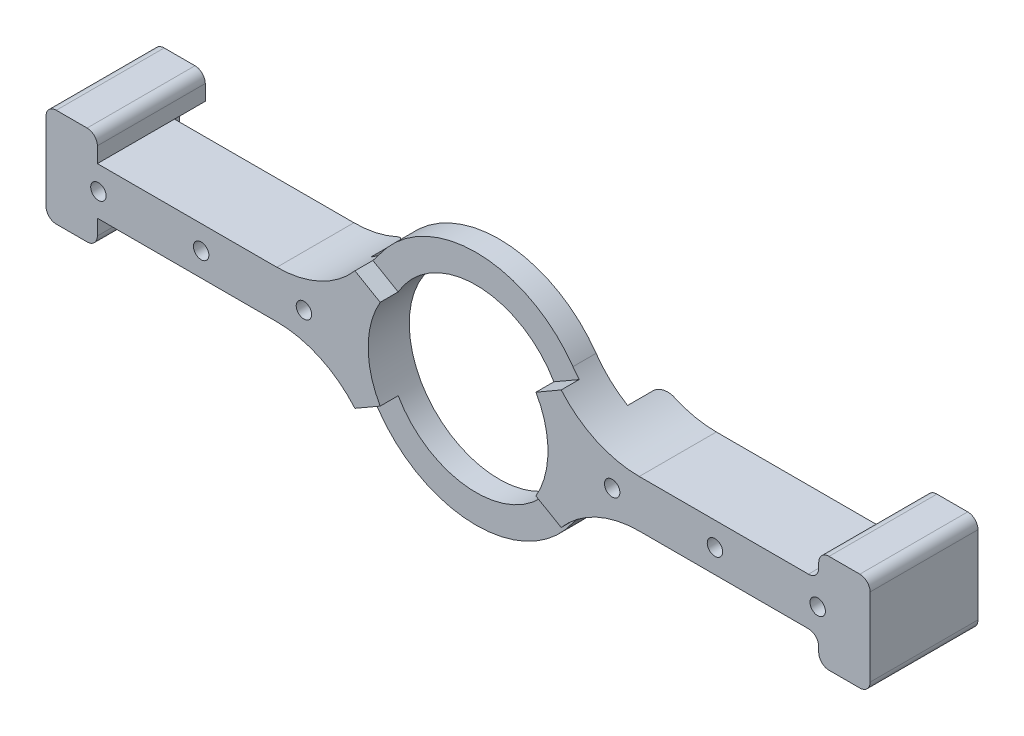
from build123d import *
from build123d.topology import SkipClean

# Parameters (mm, degrees)
SKETCH_1_R                  = 17.500000000000004
SKETCH_1_R_2                = 1.4999999999999971
SKETCH_1_R_3                = 1.4999999999999967
SKETCH_1_R_4                = 1.499999999999997
EXTRUDE_1_DEPTH             = 8
CUT_EXTRUDE_START           = -3.5
CUT_EXTRUDE_1_DEPTH         = 3.5
FILLET_1_R                  = 20
EXTRUDE_START               = 7
SKETCH_3_R                  = 1.499999999999997
SKETCH_3_R_2                = 1.4999999999999967
SKETCH_3_R_3                = 1.4999999999999971
EXTRUDE_2_DEPTH             = 7
EXTRUDE_3_DEPTH             = 6
EXTRUDE_3_DIRECTION_2_REACH = 82.056
FILLET_2_R                  = 2


with BuildPart() as part:
    # Sketch 1 → 凸台-拉伸1 (new body)
    with BuildSketch(Plane.XY):
        with BuildLine():
            Line((22.535305633605237, 4.6), (75.19999999999999, 4.599999999999999))
            Line((75.19999999999999, 4.599999999999999), (75.19999999999999, -4.6000000000000005))
            Line((75.19999999999999, -4.6000000000000005), (22.535305633605237, -4.6))
            ThreePointArc((22.535305633605237, -4.6), (1.41e-15, -23), (-22.535305633605237, -4.6))
            Line((-22.535305633605237, -4.6), (-75.19999999999999, -4.6000000000000005))
            Line((-75.19999999999999, -4.6000000000000005), (-75.19999999999999, 4.599999999999999))
            Line((-75.19999999999999, 4.599999999999999), (-22.535305633605237, 4.6))
            ThreePointArc((-22.535305633605237, 4.6), (1.41e-15, 23), (22.535305633605237, 4.6))
        make_face()
        Circle(SKETCH_1_R, mode=Mode.SUBTRACT)
        with Locations((-69.99999999999999, 0)):
            Circle(SKETCH_1_R_2, mode=Mode.SUBTRACT)
        with Locations((-49.999999999999986, 0)):
            Circle(SKETCH_1_R_3, mode=Mode.SUBTRACT)
        with Locations((-29.999999999999986, 0)):
            Circle(SKETCH_1_R_4, mode=Mode.SUBTRACT)
        with Locations((30.00000000000003, 0)):
            Circle(SKETCH_1_R_3, mode=Mode.SUBTRACT)
        with Locations((50.00000000000003, 0)):
            Circle(SKETCH_1_R_3, mode=Mode.SUBTRACT)
        with Locations((70.00000000000001, 0)):
            Circle(SKETCH_1_R_2, mode=Mode.SUBTRACT)
    extrude(amount=EXTRUDE_1_DEPTH)

    # 草图2 → 切除-拉伸1 (cut)
    with BuildSketch(Plane.XY.offset(8).offset(CUT_EXTRUDE_START)):
        with BuildLine():
            ThreePointArc((19.918584287042115, 11.499999999999945), (8.9e-16, 23), (-19.91858428704211, 11.499999999999947))
            Line((-19.918584287042115, 11.499999999999943), (-15.155444566227704, 8.749999999999961))
            ThreePointArc((-15.15544456622793, 8.74999999999957), (1.07e-15, 17.500000000000004), (15.15544456622793, 8.749999999999568))
            Line((15.155444566227706, 8.749999999999966), (19.918584287042123, 11.499999999999952))
        make_face()
        with BuildLine():
            ThreePointArc((15.155444566227922, -8.749999999999579), (-3.21e-15, -17.500000000000004), (-15.155444566227935, -8.74999999999956))
            Line((-15.155444566227704, -8.749999999999961), (-19.918584287042123, -11.499999999999947))
            ThreePointArc((-19.918584287042123, -11.499999999999943), (-2.66e-15, -23), (19.918584287042115, -11.49999999999995))
            Line((19.918584287042123, -11.499999999999952), (15.155444566227702, -8.749999999999964))
        make_face()
    extrude(amount=CUT_EXTRUDE_1_DEPTH, mode=Mode.SUBTRACT)

    # 圆角1
    fillet_1_edges = [part.edges().sort_by_distance(p)[0] for p in [
        (-22.53530563360524, -4.600000000000001, 4),
        (-22.53530563360524, 4.6, 4),
        (22.53530563360524, -4.6, 4),
        (22.53530563360524, 4.600000000000001, 4),
    ]]
    fillet(fillet_1_edges, radius=FILLET_1_R)

    # 草图3 → 凸台-拉伸2 (add)
    # profile 1 of 2: a face of its own
    with SkipClean():  # the faces are left unmerged after this step: merging them gives an invalid solid
        with BuildSketch(Plane(origin=(0, 0, 0), x_dir=(-1, 0, 0), z_dir=(0, 0, -1)).offset(EXTRUDE_START)):
            with BuildLine():
                ThreePointArc((35.26811591225139, 4.599999999999994), (29.94169047325186, 5.3223136231865595), (25.00000000000001, 7.437080795722139))
                Line((25.000000000000014, 7.437080795722148), (25.000000000000007, -7.437080795722132))
                ThreePointArc((25.00000000000001, -7.437080795722135), (29.94169047325186, -5.3223136231865595), (35.26811591225139, -4.600000000000005))
                Line((35.26811591225139, -4.600000000000003), (75.19999999999999, -4.6000000000000005))
                Line((75.19999999999999, -4.6000000000000005), (75.19999999999999, 4.599999999999999))
                Line((75.19999999999999, 4.599999999999999), (35.26811591225139, 4.6))
            make_face()
            with Locations((29.999999999999986, 0)):
                Circle(SKETCH_3_R, mode=Mode.SUBTRACT)
            with Locations((49.999999999999986, 0)):
                Circle(SKETCH_3_R_2, mode=Mode.SUBTRACT)
            with Locations((69.99999999999999, 0)):
                Circle(SKETCH_3_R_3, mode=Mode.SUBTRACT)
        # profile 2 of 2: a face of its own
        with BuildSketch(Plane(origin=(0, 0, 0), x_dir=(-1, 0, 0), z_dir=(0, 0, -1)).offset(EXTRUDE_START)):
            with BuildLine():
                Line((-25, -7.437080795722138), (-25.000000000000007, 7.437080795722141))
                ThreePointArc((-25.000000000000004, 7.437080795722139), (-29.94169047325186, 5.322313623186556), (-35.268115912251396, 4.600000000000001))
                Line((-35.268115912251396, 4.600000000000003), (-75.19999999999999, 4.599999999999999))
                Line((-75.19999999999999, 4.599999999999999), (-75.19999999999999, -4.6000000000000005))
                Line((-75.19999999999999, -4.6000000000000005), (-35.26811591225139, -4.6))
                ThreePointArc((-35.26811591225139, -4.600000000000001), (-29.941690473251857, -5.3223136231865595), (-25.000000000000004, -7.437080795722142))
            make_face()
            with Locations((-70.00000000000001, 0)):
                Circle(SKETCH_3_R_3, mode=Mode.SUBTRACT)
            with Locations((-50.00000000000003, 0)):
                Circle(SKETCH_3_R_2, mode=Mode.SUBTRACT)
            with Locations((-30.00000000000003, 0)):
                Circle(SKETCH_3_R_2, mode=Mode.SUBTRACT)
        extrude(amount=-EXTRUDE_2_DEPTH)

    # 草图4 → 凸台-拉伸3 (add)
    with SkipClean():  # the faces are left unmerged after this step: merging them gives an invalid solid
        with BuildSketch(Plane(origin=(0, 0, -7), x_dir=(-1, 0, 0), z_dir=(0, 0, -1))):
            Polygon((-75.19999999999999, 4.599999999999999), (-70.19999999999999, 4.599999999999999), (-70.19999999999999, 9.599999999999994), (-80.19999999999999, 9.59999999999999), (-80.19999999999999, -9.600000000000001), (-70.19999999999999, -9.600000000000001), (-70.19999999999999, -4.6), (-75.19999999999999, -4.6000000000000005), align=None)
            Polygon((70.19999999999999, -4.599999999999983), (70.19999999999999, -9.599999999999984), (80.19999999999999, -9.599999999999982), (80.19999999999999, 9.60000000000001), (70.19999999999999, 9.600000000000012), (70.19999999999999, 4.600000000000011), (75.19999999999999, 4.599999999999999), (75.19999999999999, -4.599999999999982), align=None)
        extrude(amount=EXTRUDE_3_DEPTH)

    # 凸台-拉伸3 direction 2: up to this face of the body (flat: up to its plane)
    extrude_3_direction_2_end = Plane(part.part.faces().sort_by_distance((41.665657834, 0, 8))[0])
    # 草图4 → 凸台-拉伸3 direction 2 (add, up to the picked face)
    with BuildSketch(Plane(origin=(0, 0, -7), x_dir=(-1, 0, 0), z_dir=(0, 0, -1)), mode=Mode.PRIVATE) as extrude_3_direction_2_sk1:
        Polygon((-75.19999999999999, 4.599999999999999), (-70.19999999999999, 4.599999999999999), (-70.19999999999999, 9.599999999999994), (-80.19999999999999, 9.59999999999999), (-80.19999999999999, -9.600000000000001), (-70.19999999999999, -9.600000000000001), (-70.19999999999999, -4.6), (-75.19999999999999, -4.6000000000000005), align=None)
    extrude_3_direction_2_tool1 = split(extrude(extrude_3_direction_2_sk1.sketch, amount=-EXTRUDE_3_DIRECTION_2_REACH, mode=Mode.PRIVATE), bisect_by=extrude_3_direction_2_end, keep=Keep.BOTH, mode=Mode.PRIVATE)
    # 草图4 → 凸台-拉伸3 direction 2 (add, up to the picked face)
    with BuildSketch(Plane(origin=(0, 0, -7), x_dir=(-1, 0, 0), z_dir=(0, 0, -1)), mode=Mode.PRIVATE) as extrude_3_direction_2_sk2:
        Polygon((70.19999999999999, -4.599999999999983), (70.19999999999999, -9.599999999999984), (80.19999999999999, -9.599999999999982), (80.19999999999999, 9.60000000000001), (70.19999999999999, 9.600000000000012), (70.19999999999999, 4.600000000000011), (75.19999999999999, 4.599999999999999), (75.19999999999999, -4.599999999999982), align=None)
    extrude_3_direction_2_tool2 = split(extrude(extrude_3_direction_2_sk2.sketch, amount=-EXTRUDE_3_DIRECTION_2_REACH, mode=Mode.PRIVATE), bisect_by=extrude_3_direction_2_end, keep=Keep.BOTH, mode=Mode.PRIVATE)
    add(extrude_3_direction_2_tool1.solids().sort_by(Axis((75.987671, 0, -7), (0, 0, 1)))[0])
    add(extrude_3_direction_2_tool2.solids().sort_by(Axis((-75.987671, 0, -7), (0, 0, 1)))[0])

    # 圆角2
    # the kernel refuses this fillet: 2 mm, written as the material it adds along each edge
    with BuildSketch(Plane(origin=(70.19999999999999, 4.599999999999996, 0), x_dir=(-1, 1.33e-15, 0), z_dir=(0, 0, 1))) as fillet_2_piece_1:
        with BuildLine():
            CenterArc((FILLET_2_R, -FILLET_2_R), FILLET_2_R, 90.00000000000007, 89.99999999999993)
            Line((2.66e-15, -FILLET_2_R), (0, 0))
            Line((0, 0), (FILLET_2_R, 0))
        make_face()
    extrude(amount=8)
    with BuildSketch(Plane(origin=(70.19999999999999, -4.6, 0), x_dir=(-1, -4.4e-16, 0), z_dir=(0, 0, 1))) as fillet_2_piece_2:
        with BuildLine():
            CenterArc((FILLET_2_R, FILLET_2_R), FILLET_2_R, 180, 90)
            Line((8.9e-16, FILLET_2_R), (0, 0))
            Line((0, 0), (FILLET_2_R, 0))
        make_face()
    extrude(amount=8)
    with BuildSketch(Plane(origin=(70.19999999999999, -4.6, -7), x_dir=(-1, -4.4e-16, 0), z_dir=(0, 0, 1))) as fillet_2_piece_3:
        with BuildLine():
            CenterArc((FILLET_2_R, FILLET_2_R), FILLET_2_R, 180, 90)
            Line((8.9e-16, FILLET_2_R), (0, 0))
            Line((0, 0), (FILLET_2_R, 0))
        make_face()
    extrude(amount=7)
    with BuildSketch(Plane(origin=(70.19999999999999, 4.599999999999996, -7), x_dir=(-1, 1.78e-15, 0), z_dir=(0, 0, 1))) as fillet_2_piece_4:
        with BuildLine():
            CenterArc((FILLET_2_R, -FILLET_2_R), FILLET_2_R, 90.0000000000001, 89.9999999999999)
            Line((3.55e-15, -FILLET_2_R), (0, 0))
            Line((0, 0), (FILLET_2_R, 0))
        make_face()
    extrude(amount=7)
    # the kernel refuses this fillet: 2 mm, written as the material it takes off along each edge
    with BuildSketch(Plane(origin=(24.999999999999996, -12.437080795722139, -7), x_dir=(1, -4.8e-16, 0), z_dir=(4.8e-16, 1, 0))) as fillet_2_2_piece_1:
        with BuildLine():
            CenterArc((FILLET_2_R, -FILLET_2_R), FILLET_2_R, 90, 90)
            Line((0, -FILLET_2_R), (0, 0))
            Line((0, 0), (FILLET_2_R, 0))
        make_face()
    extrude(amount=24.87416159144428, mode=Mode.SUBTRACT)
    with BuildSketch(Plane(origin=(-25.000000000000018, 12.437080795722148, -7), x_dir=(0, 0, 1), z_dir=(4.8e-16, -1, 0))) as fillet_2_2_piece_2:
        with BuildLine():
            CenterArc((FILLET_2_R, FILLET_2_R), FILLET_2_R, 180, 90)
            Line((0, FILLET_2_R), (0, 0))
            Line((0, 0), (FILLET_2_R, 0))
        make_face()
    extrude(amount=24.87416159144428, mode=Mode.SUBTRACT)
    with BuildSketch(Plane(origin=(70.19999999999999, -9.600000000000001, -7), x_dir=(1, 0, 0), z_dir=(0, 0, 1)), Plane(origin=(-70.19999999999999, 9.600000000000012, -7), x_dir=(-1, 0, 0), z_dir=(0, 0, 1))) as fillet_2_2_piece_3:
        with BuildLine():
            CenterArc((FILLET_2_R, FILLET_2_R), FILLET_2_R, 180, 90)
            Line((0, FILLET_2_R), (0, 0))
            Line((0, 0), (FILLET_2_R, 0))
        make_face()
    extrude(amount=20, mode=Mode.SUBTRACT)
    with BuildSketch(Plane(origin=(80.19999999999999, -9.600000000000001, -7), x_dir=(0, 1, 0), z_dir=(0, 0, 1)), Plane(origin=(-70.19999999999999, -9.599999999999984, -7), x_dir=(0, 1, 0), z_dir=(0, 0, 1))) as fillet_2_2_piece_4:
        with BuildLine():
            CenterArc((FILLET_2_R, FILLET_2_R), FILLET_2_R, 180, 90)
            Line((0, FILLET_2_R), (0, 0))
            Line((0, 0), (FILLET_2_R, 0))
        make_face()
    extrude(amount=20, mode=Mode.SUBTRACT)
    with BuildSketch(Plane(origin=(80.19999999999999, 9.59999999999999, -7), x_dir=(-1, 0, 0), z_dir=(0, 0, 1)), Plane(origin=(-80.19999999999999, -9.599999999999982, -7), x_dir=(1, 0, 0), z_dir=(0, 0, 1))) as fillet_2_2_piece_5:
        with BuildLine():
            CenterArc((FILLET_2_R, FILLET_2_R), FILLET_2_R, 180.00000000000003, 90)
            Line((0, FILLET_2_R), (0, 0))
            Line((0, 0), (FILLET_2_R, 0))
        make_face()
    extrude(amount=20, mode=Mode.SUBTRACT)
    with BuildSketch(Plane(origin=(70.19999999999999, 9.599999999999994, -7), x_dir=(0, -1, 0), z_dir=(0, 0, 1))) as fillet_2_2_piece_6:
        with BuildLine():
            CenterArc((FILLET_2_R, FILLET_2_R), FILLET_2_R, 180, 90)
            Line((0, FILLET_2_R), (0, 0))
            Line((0, 0), (FILLET_2_R, 0))
        make_face()
    extrude(amount=20.000000000000004, mode=Mode.SUBTRACT)
    with BuildSketch(Plane(origin=(-80.19999999999999, 9.60000000000001, -7), x_dir=(0, -1, 0), z_dir=(0, 0, 1))) as fillet_2_2_piece_7:
        with BuildLine():
            CenterArc((FILLET_2_R, FILLET_2_R), FILLET_2_R, 180, 90)
            Line((0, FILLET_2_R), (0, 0))
            Line((0, 0), (FILLET_2_R, 0))
        make_face()
    extrude(amount=20, mode=Mode.SUBTRACT)
    with BuildSketch(Plane(origin=(-70.19999999999999, -9.599999999999984, -7), x_dir=(0, 1, 0), z_dir=(0, 0, -1)), Plane(origin=(80.19999999999999, -9.600000000000001, -7), x_dir=(0, 1, 0), z_dir=(0, 0, -1))) as fillet_2_2_piece_8:
        with BuildLine():
            CenterArc((FILLET_2_R, -FILLET_2_R), FILLET_2_R, 90, 90)
            Line((0, -FILLET_2_R), (0, 0))
            Line((0, 0), (FILLET_2_R, 0))
        make_face()
    extrude(amount=11, mode=Mode.SUBTRACT)
    with BuildSketch(Plane(origin=(-80.19999999999999, -9.599999999999982, -7), x_dir=(1, 0, 0), z_dir=(0, 0, -1)), Plane(origin=(80.19999999999999, 9.59999999999999, -7), x_dir=(-1, 0, 0), z_dir=(0, 0, -1))) as fillet_2_2_piece_9:
        with BuildLine():
            CenterArc((FILLET_2_R, -FILLET_2_R), FILLET_2_R, 90, 89.99999999999997)
            Line((0, -FILLET_2_R), (0, 0))
            Line((0, 0), (FILLET_2_R, 0))
        make_face()
    extrude(amount=11, mode=Mode.SUBTRACT)
    with BuildSketch(Plane(origin=(-80.19999999999999, 9.60000000000001, -7), x_dir=(0, -1, 0), z_dir=(0, 0, -1))) as fillet_2_2_piece_10:
        with BuildLine():
            CenterArc((FILLET_2_R, -FILLET_2_R), FILLET_2_R, 90, 90)
            Line((0, -FILLET_2_R), (0, 0))
            Line((0, 0), (FILLET_2_R, 0))
        make_face()
    extrude(amount=11, mode=Mode.SUBTRACT)
    with BuildSketch(Plane(origin=(-70.19999999999999, 9.600000000000012, -7), x_dir=(-1, 0, 0), z_dir=(0, 0, -1))) as fillet_2_2_piece_11:
        with BuildLine():
            CenterArc((FILLET_2_R, -FILLET_2_R), FILLET_2_R, 90, 90)
            Line((0, -FILLET_2_R), (0, 0))
            Line((0, 0), (FILLET_2_R, 0))
        make_face()
    extrude(amount=11, mode=Mode.SUBTRACT)
    with BuildSketch(Plane(origin=(70.19999999999999, 9.599999999999994, -7), x_dir=(0, -1, 0), z_dir=(0, 0, -1))) as fillet_2_2_piece_12:
        with BuildLine():
            CenterArc((FILLET_2_R, -FILLET_2_R), FILLET_2_R, 90, 90)
            Line((0, -FILLET_2_R), (0, 0))
            Line((0, 0), (FILLET_2_R, 0))
        make_face()
    extrude(amount=11, mode=Mode.SUBTRACT)
    with BuildSketch(Plane(origin=(70.19999999999999, -9.600000000000001, -7), x_dir=(0, 1, 0), z_dir=(0, 0, -1))) as fillet_2_2_piece_13:
        with BuildLine():
            CenterArc((FILLET_2_R, FILLET_2_R), FILLET_2_R, 180, 90)
            Line((0, FILLET_2_R), (0, 0))
            Line((0, 0), (FILLET_2_R, 0))
        make_face()
    extrude(amount=11, mode=Mode.SUBTRACT)


solid = part.part
